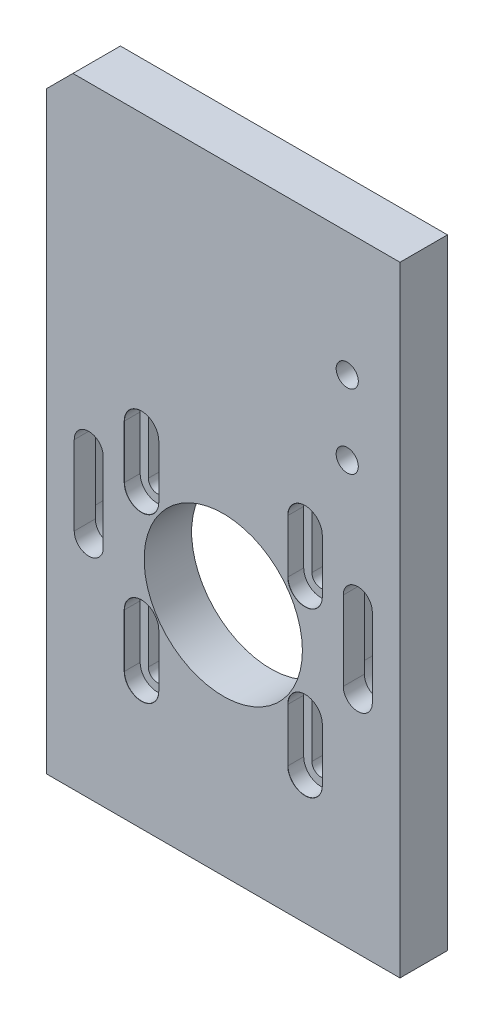
from build123d import *

# Parameters (mm, degrees)
BOSS_EXTRUDE1_DEPTH             = 9
SKETCH2_R                       = 15
MOTOR_HOLE_DEPTH                = 123.513264588
CBORE_START                     = -1
CBORE_SLOT_FOR_M3_SHCS1_DEPTH   = 10
CBORE_START_2                   = 6
CBORE_SLOT_FOR_M3_SHCS1_2_DEPTH = 3
LPATTERN2_COUNT                 = 2
LPATTERN2_PITCH                 = 31
LPATTERN2_COUNT_DIR2            = 2
LPATTERN2_PITCH_DIR2            = 31
CBORE_SLOT_FOR_M5_SHCS1_DEPTH   = 5
CBORE_START_3                   = 5
CBORE_SLOT_FOR_M5_SHCS1_2_DEPTH = 4
M5X0_8_TAPPED_HOLE1_D           = 4.2


with BuildPart() as part:
    # Sketch1 → Boss-Extrude1 (new body)
    with BuildSketch(Plane.XY):
        Polygon((-33.5, 0), (33.5, 0), (33.5, 117.5), (-28.5, 117.5), (-33.5, 112.5), align=None)
    extrude(amount=BOSS_EXTRUDE1_DEPTH)

    # Sketch2 → Motor Hole (cut, through all)
    with BuildSketch(Plane.XY.offset(9)):
        with Locations((0, 44.5)):
            Circle(SKETCH2_R)
    extrude(amount=-MOTOR_HOLE_DEPTH, mode=Mode.SUBTRACT)

    # CBORE SLOT for M3 SHCS1: read off the stored shape, not the designer's step
    # CBORE SLOT for M3 SHCS1 outline → CBORE SLOT for M3 SHCS1 (cut)
    with BuildSketch(Plane.XY.offset(CBORE_START)):
        with BuildLine():
            Line((-13.8, 55.2), (-13.8, 65.3))
            ThreePointArc((-13.8, 65.3), (-15.5, 67), (-17.2, 65.3))
            Line((-17.2, 65.3), (-17.2, 55.2))
            ThreePointArc((-17.2, 55.2), (-15.5, 53.5), (-13.8, 55.2))
        make_face()
    cbore_slot_for_m3_shcs1 = extrude(amount=CBORE_SLOT_FOR_M3_SHCS1_DEPTH, mode=Mode.SUBTRACT)

    # CBORE SLOT for M3 SHCS1 2 outline → CBORE SLOT for M3 SHCS1 2 (cut)
    with BuildSketch(Plane.XY.offset(CBORE_START_2)):
        with BuildLine():
            Line((-12.25, 55.2), (-12.25, 65.3))
            ThreePointArc((-12.25, 65.3), (-15.5, 68.55), (-18.75, 65.3))
            Line((-18.75, 65.3), (-18.75, 55.2))
            ThreePointArc((-18.75, 55.2), (-15.5, 51.95), (-12.25, 55.2))
        make_face()
        with BuildLine():
            ThreePointArc((-17.2, 65.3), (-15.5, 67), (-13.8, 65.3))
            Line((-13.8, 65.3), (-13.8, 55.2))
            ThreePointArc((-13.8, 55.2), (-15.5, 53.5), (-17.2, 55.2))
            Line((-17.2, 55.2), (-17.2, 65.3))
        make_face(mode=Mode.SUBTRACT)
    cbore_slot_for_m3_shcs1_2 = extrude(amount=CBORE_SLOT_FOR_M3_SHCS1_2_DEPTH, mode=Mode.SUBTRACT)

    # CBORE SLOT for M3 SHCS1 3: loft between two sections, ruled curve by curve
    cbore_slot_for_m3_shcs1_3_from = [
        Edge.make_three_point_arc((-12.25, 65.3, 8.975), (-13.201902961, 67.598097039, 8.975), (-15.5, 68.55, 8.975)),
        Edge.make_three_point_arc((-15.5, 68.55, 8.975), (-17.798097039, 67.598097039, 8.975), (-18.75, 65.3, 8.975)),
        Edge.make_three_point_arc((-18.75, 55.2, 8.975), (-17.798097039, 52.901902961, 8.975), (-15.5, 51.95, 8.975)),
        Edge.make_three_point_arc((-15.5, 51.95, 8.975), (-13.201902961, 52.901902961, 8.975), (-12.25, 55.2, 8.975)),
        Edge.make_line((-18.75, 65.3, 8.975), (-18.75, 55.2, 8.975)),
        Edge.make_line((-12.25, 65.3, 8.975), (-12.25, 55.2, 8.975)),
    ]
    cbore_slot_for_m3_shcs1_3_to = [
        Edge.make_three_point_arc((-12.225, 65.3, 9), (-13.184225292, 67.615774708, 9), (-15.5, 68.575, 9)),
        Edge.make_three_point_arc((-15.5, 68.575, 9), (-17.815774708, 67.615774708, 9), (-18.775, 65.3, 9)),
        Edge.make_three_point_arc((-18.775, 55.2, 9), (-17.815774708, 52.884225292, 9), (-15.5, 51.925, 9)),
        Edge.make_three_point_arc((-15.5, 51.925, 9), (-13.184225292, 52.884225292, 9), (-12.225, 55.2, 9)),
        Edge.make_line((-18.775, 65.3, 9), (-18.775, 55.2, 9)),
        Edge.make_line((-12.225, 65.3, 9), (-12.225, 55.2, 9)),
    ]
    cbore_slot_for_m3_shcs1_3 = Solid(Shell([*[Face.make_surface_from_curves(cbore_slot_for_m3_shcs1_3_from[k], cbore_slot_for_m3_shcs1_3_to[k]) for k in range(6)], Face(Wire(cbore_slot_for_m3_shcs1_3_from)), Face(Wire(cbore_slot_for_m3_shcs1_3_to))]))
    add(cbore_slot_for_m3_shcs1_3, mode=Mode.SUBTRACT)

    # LPattern2: CBORE SLOT for M3 SHCS1, CBORE SLOT for M3 SHCS1 2, CBORE SLOT for M3 SHCS1 3 2 × 2
    with Locations(*[(i * LPATTERN2_PITCH, -j * LPATTERN2_PITCH_DIR2, 0) for i in range(LPATTERN2_COUNT) for j in range(LPATTERN2_COUNT_DIR2) if (i, j) != (0, 0)]):
        add(cbore_slot_for_m3_shcs1, mode=Mode.SUBTRACT)
        add(cbore_slot_for_m3_shcs1_2, mode=Mode.SUBTRACT)
        add(cbore_slot_for_m3_shcs1_3, mode=Mode.SUBTRACT)

    # CBORE SLOT for M5 SHCS1: read off the stored shape, not the designer's step
    # CBORE SLOT for M5 SHCS1 outline → CBORE SLOT for M5 SHCS1 (cut)
    with BuildSketch(Plane.XY):
        with BuildLine():
            ThreePointArc((20.5, 42.5), (25.5, 37.5), (30.5, 42.5))
            Line((30.5, 42.5), (30.5, 57.5))
            ThreePointArc((30.5, 57.5), (25.5, 62.5), (20.5, 57.5))
            Line((20.5, 57.5), (20.5, 42.5))
        make_face()
    cbore_slot_for_m5_shcs1 = extrude(amount=CBORE_SLOT_FOR_M5_SHCS1_DEPTH, mode=Mode.SUBTRACT)

    # CBORE SLOT for M5 SHCS1 2 outline → CBORE SLOT for M5 SHCS1 2 (cut)
    with BuildSketch(Plane.XY.offset(CBORE_START_3)):
        with BuildLine():
            ThreePointArc((22.75, 42.5), (25.5, 39.75), (28.25, 42.5))
            Line((28.25, 42.5), (28.25, 57.5))
            ThreePointArc((28.25, 57.5), (25.5, 60.25), (22.75, 57.5))
            Line((22.75, 57.5), (22.75, 42.5))
        make_face()
    cbore_slot_for_m5_shcs1_2 = extrude(amount=CBORE_SLOT_FOR_M5_SHCS1_2_DEPTH, mode=Mode.SUBTRACT)

    # CBORE SLOT for M5 SHCS1 3: loft between two sections, ruled curve by curve
    cbore_slot_for_m5_shcs1_3_from = [
        Edge.make_three_point_arc((30.5, 42.5, 0.025), (29.035533906, 38.964466094, 0.025), (25.5, 37.5, 0.025)),
        Edge.make_three_point_arc((25.5, 37.5, 0.025), (21.964466094, 38.964466094, 0.025), (20.5, 42.5, 0.025)),
        Edge.make_three_point_arc((20.5, 57.5, 0.025), (21.964466094, 61.035533906, 0.025), (25.5, 62.5, 0.025)),
        Edge.make_three_point_arc((25.5, 62.5, 0.025), (29.035533906, 61.035533906, 0.025), (30.5, 57.5, 0.025)),
        Edge.make_line((20.5, 42.5, 0.025), (20.5, 57.5, 0.025)),
        Edge.make_line((30.5, 42.5, 0.025), (30.5, 57.5, 0.025)),
    ]
    cbore_slot_for_m5_shcs1_3_to = [
        Edge.make_three_point_arc((30.525, 42.5, 0), (29.053211575, 38.946788425, 0), (25.5, 37.475, 0)),
        Edge.make_three_point_arc((25.5, 37.475, 0), (21.946788425, 38.946788425, 0), (20.475, 42.5, 0)),
        Edge.make_three_point_arc((20.475, 57.5, 0), (21.946788425, 61.053211575, 0), (25.5, 62.525, 0)),
        Edge.make_three_point_arc((25.5, 62.525, 0), (29.053211575, 61.053211575, 0), (30.525, 57.5, 0)),
        Edge.make_line((20.475, 42.5, 0), (20.475, 57.5, 0)),
        Edge.make_line((30.525, 42.5, 0), (30.525, 57.5, 0)),
    ]
    cbore_slot_for_m5_shcs1_3 = Solid(Shell([*[Face.make_surface_from_curves(cbore_slot_for_m5_shcs1_3_from[k], cbore_slot_for_m5_shcs1_3_to[k]) for k in range(6)], Face(Wire(cbore_slot_for_m5_shcs1_3_from)), Face(Wire(cbore_slot_for_m5_shcs1_3_to))]))
    add(cbore_slot_for_m5_shcs1_3, mode=Mode.SUBTRACT)

    # Mirror1: CBORE SLOT for M5 SHCS1, CBORE SLOT for M5 SHCS1 2, CBORE SLOT for M5 SHCS1 3 across plane
    add(cbore_slot_for_m5_shcs1.mirror(Plane(origin=(0, 0, 0), x_dir=(0, 0, 1), z_dir=(1, 0, 0))), mode=Mode.SUBTRACT)
    add(cbore_slot_for_m5_shcs1_2.mirror(Plane(origin=(0, 0, 0), x_dir=(0, 0, 1), z_dir=(1, 0, 0))), mode=Mode.SUBTRACT)
    add(cbore_slot_for_m5_shcs1_3.mirror(Plane(origin=(0, 0, 0), x_dir=(0, 0, 1), z_dir=(1, 0, 0))), mode=Mode.SUBTRACT)

    # M5x0.8 Tapped Hole1 (through all)
    with Locations(Plane.XY.offset(9)):
        with Locations((23.5, 94), (23.5, 80)):
            Hole(M5X0_8_TAPPED_HOLE1_D / 2)


solid = part.part
